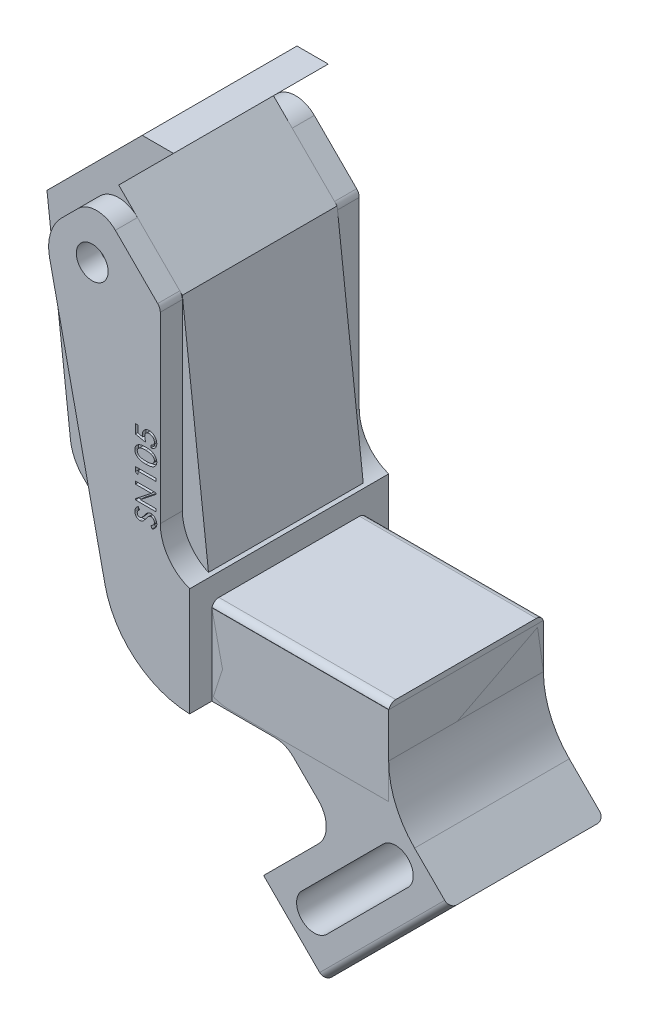
from build123d import *

# Parameters (mm, degrees)
BOSS_EXTRUDE1_DEPTH     = 11.1125
BOSS_EXTRUDE2_DEPTH     = 11.1125
FILLET6_R               = 3.175
FILLET7_R               = 12.7
CUT_EXTRUDE1_DEPTH      = 277.494438503
CUT_EXTRUDE1_DEPTH_BACK = 277.494438503
SKETCH3_R               = 2.286
FILLET9_R               = 6.35
SKETCH4_R               = 2.286
BOSS_EXTRUDE3_DEPTH     = 3.175
BOSS_EXTRUDE4_DEPTH     = 28.575
FILLET10_R              = 6.35
SKETCH7_W               = 22.225
SKETCH7_H               = 12.93
CUT_EXTRUDE4_DEPTH      = 169.905984291
FILLET11_R              = 1.016
BOSS_EXTRUDE5_DEPTH     = 22.225
FILLET12_START          = -11.1125
FILLET12_DEPTH          = 22.225
BOSS_EXTRUDE6_DEPTH     = 22.225
FILLET13_R              = 12.7
FILLET14_R              = 1.016
CUT_EXTRUDE5_DEPTH      = 286.708740637
FILLET15_R              = 3.81
FILLET16_R              = 3.81
FILLET17_R              = 1.27
FILLET18_R              = 1.27
CUT_EXTRUDE6_DEPTH      = 0.5
CUT_EXTRUDE7_DEPTH      = 0.5


with BuildPart() as part:
    # Sketch1 → Boss-Extrude1 (new, symmetric)
    with BuildSketch(Plane.XY):
        with BuildLine():
            Line((217.494802693, 42.707577478), (234.037042979, 26.165337192))
            ThreePointArc((234.037042979, 26.165337192), (236.097131244, 24.788830222), (238.527171039, 24.305465253))
            Line((238.527171039, 24.305465253), (261.378110414, 24.305465253))
            Line((261.378110414, 24.305465253), (261.378110414, 35.735465253))
            Line((261.378110414, 35.735465253), (235.978110414, 35.735465253))
            Line((235.978110414, 35.735465253), (231.749220619, 72.474188019))
            Line((231.749220619, 72.474188019), (222.607319888, 81.61608875))
            Line((222.607319888, 81.61608875), (230.47402425, 89.482793112))
            Line((230.47402425, 89.482793112), (225.983896189, 89.482793112))
            Line((225.983896189, 89.482793112), (212.300717241, 75.799614165))
            Line((212.300717241, 75.799614165), (213.707886072, 63.574754203))
            Line((213.707886072, 63.574754203), (215.67658494, 46.47156981))
            ThreePointArc((215.67658494, 46.47156981), (216.267092957, 44.435671699), (217.494802693, 42.707577478))
        make_face()
    extrude(amount=BOSS_EXTRUDE1_DEPTH, both=True)


with BuildPart() as body_2:
    # Sketch2 → Boss-Extrude2 (new, symmetric)
    with BuildSketch(Plane.XY):
        Polygon((233.302439438, 24.104081998), (225.983896189, 24.104081998), (215.12365511, 74.132423973), (222.607319888, 81.61608875), (231.750210568, 72.47319807), (231.750210568, 36.499281998), (247.333746609, 36.499281998), (261.378110414, 36.499281998), (261.378110414, 24.104081998), (247.333746609, 24.104081998), align=None)
    extrude(amount=BOSS_EXTRUDE2_DEPTH, both=True)

    # Fillet6
    fillet6_edges = [body_2.edges().sort_by_distance(p)[0] for p in [
        (231.750210568, 36.499281998, 0),
    ]]
    fillet(fillet6_edges, radius=FILLET6_R)

    # Fillet7
    fillet7_edges = [body_2.edges().sort_by_distance(p)[0] for p in [
        (225.983896189, 24.104081998, 0),
    ]]
    fillet(fillet7_edges, radius=FILLET7_R)

    # Sketch3 → Cut-Extrude1 (cut, two sides: drawn at the far end of the back side and taken through both)
    with BuildSketch(Plane.XY.offset(-CUT_EXTRUDE1_DEPTH_BACK)):
        with Locations((221.978701959, 73.264450558)):
            Circle(SKETCH3_R)
    extrude(amount=CUT_EXTRUDE1_DEPTH + CUT_EXTRUDE1_DEPTH_BACK, mode=Mode.SUBTRACT)

    # Fillet9
    fillet9_edges = [body_2.edges().sort_by_distance(p)[0] for p in [
        (215.12365511, 74.132423973, 0),
    ]]
    fillet(fillet9_edges, radius=FILLET9_R)

    # Sketch4 → Boss-Extrude3 (add)
    with BuildSketch(Plane.XY.offset(11.1125)):
        with BuildLine():
            Line((235.978110414, 24.106438526), (235.978110414, 36.49692547))
            Line((235.978110414, 36.49692547), (235.978110414, 36.499281998))
            Line((235.978110414, 36.499281998), (234.925210568, 36.499281998))
            ThreePointArc((234.925210568, 36.499281998), (232.680146538, 37.429217968), (231.750210568, 39.674281998))
            Line((231.750210568, 39.674281998), (231.750210568, 72.47319807))
            Line((231.750210568, 72.47319807), (222.607319888, 81.61608875))
            Line((222.607319888, 81.61608875), (217.574184638, 76.582953501))
            ThreePointArc((217.574184638, 76.582953501), (215.971921031, 73.883150485), (215.858844337, 70.745731378))
            Line((215.858844337, 70.745731378), (223.811816826, 34.109893874))
            ThreePointArc((223.811816826, 34.109893874), (228.156886881, 26.994301425), (235.978110414, 24.106438526))
        make_face()
        with Locations((221.978701959, 73.264450558)):
            Circle(SKETCH4_R, mode=Mode.SUBTRACT)
    boss_extrude3 = extrude(amount=BOSS_EXTRUDE3_DEPTH)

    # Mirror1: Boss-Extrude3 across plane
    add(boss_extrude3.mirror(Plane.XY))

    # Sketch6 → Boss-Extrude4 (add)
    with BuildSketch(Plane.XY.offset(14.2875)):
        with BuildLine():
            Line((235.978110414, 36.499281998), (235.978110414, 39.674281998))
            Line((235.978110414, 39.674281998), (231.750210568, 39.674281998))
            ThreePointArc((231.750210568, 39.674281998), (232.680146538, 37.429217968), (234.925210568, 36.499281998))
            Line((234.925210568, 36.499281998), (235.978110414, 36.499281998))
        make_face()
    extrude(amount=-BOSS_EXTRUDE4_DEPTH)

    # Fillet10
    # the kernel refuses this fillet: 6.35 mm, written as the material it adds along each edge
    with BuildSketch(Plane(origin=(231.750210568, 39.674281998, -14.2875), x_dir=(0, 1, 0), z_dir=(0, 0, 1))) as fillet10_piece_1:
        with BuildLine():
            CenterArc((5.984913611, -6.35), FILLET10_R, 90, 70.476770951)
            Line((0, -4.227899846), (-0.119698272, -4.185457843))
            ThreePointArc((-0.119698272, -4.185457843), (-0.127, -2.113949923), (-0.127, 0))
            Line((-0.127, 0), (0, 0.127))
            Line((0, 0.127), (5.984913611, 0.127))
            Line((5.984913611, 0.127), (5.984913611, 0))
        make_face()
    extrude(amount=28.575)

    # Sketch7 → Cut-Extrude4 (cut, through all)
    with BuildSketch(Plane(origin=(152.111704319, 152.111704319, 0), x_dir=(0, 0, -1), z_dir=(0.7071067811865449, 0.7071067811865501, 0))):
        with Locations((0, -106.160855625)):
            Rectangle(SKETCH7_W, SKETCH7_H)
    extrude(amount=-CUT_EXTRUDE4_DEPTH, mode=Mode.SUBTRACT)

    # Fillet11
    fillet11_edges = [body_2.edges().sort_by_distance(p)[0] for p in [
        (248.678110414, 36.499281998, -11.1125),
        (248.678110414, 36.499281998, 11.1125),
    ]]
    fillet(fillet11_edges, radius=FILLET11_R)

    # Sketch9 → Boss-Extrude5 (add)
    with BuildSketch(Plane.XY.offset(-11.1125)):
        with BuildLine():
            Line((218.385153144, 59.108140645), (219.719882264, 60.442869765))
            Line((219.719882264, 60.442869765), (216.519192457, 75.187036407))
            ThreePointArc((216.519192457, 75.187036407), (215.783358892, 73.026698707), (215.858844337, 70.745731378))
            Line((215.858844337, 70.745731378), (218.385153144, 59.108140645))
        make_face()
    extrude(amount=BOSS_EXTRUDE5_DEPTH)

    # Fillet12: read off the stored shape, not the designer's step
    # Fillet12 outline → Fillet12 (cut)
    with BuildSketch(Plane.XY.offset(FILLET12_START)):
        with BuildLine():
            ThreePointArc((216.519192457, 75.187036407), (216.345748441, 74.853354888), (216.192361582, 74.509991154))
            ThreePointArc((216.192361582, 74.509991154), (216.449656469, 74.666313389), (216.675458361, 74.467188288))
            Line((216.675458361, 74.467188288), (216.519192457, 75.187036407))
        make_face()
    extrude(amount=FILLET12_DEPTH, mode=Mode.SUBTRACT)

    # Sketch10 → Boss-Extrude6 (add)
    with BuildSketch(Plane.XY.offset(11.1125)):
        with BuildLine():
            Line((270.142840388, 15.339352024), (261.378110414, 24.104081998))
            Line((261.378110414, 24.104081998), (246.58327829, 24.104081998))
            Line((246.58327829, 24.104081998), (245.063154175, 24.104081998))
            ThreePointArc((245.063154175, 24.104081998), (246.488038822, 23.806717506), (247.697423742, 22.996711324))
            Line((247.697423742, 22.996711324), (251.292719984, 19.42327698))
            ThreePointArc((251.292719984, 19.42327698), (252.416867116, 16.726806305), (251.300948381, 14.026919965))
            Line((251.300948381, 14.026919965), (243.417598172, 6.143569756))
            Line((243.417598172, 6.143569756), (252.182328146, -2.621160218))
            Line((252.182328146, -2.621160218), (270.142840388, 15.339352024))
        make_face()
    extrude(amount=-BOSS_EXTRUDE6_DEPTH)

    # Fillet13
    fillet13_edges = [body_2.edges().sort_by_distance(p)[0] for p in [
        (261.378110414, 24.104081998, 0),
    ]]
    fillet(fillet13_edges, radius=FILLET13_R)

    # Fillet14
    fillet14_edges = [body_2.edges().sort_by_distance(p)[0] for p in [
        (261.162584267, 6.359095903, -11.1125),
        (261.162584267, 6.359095903, 11.1125),
    ]]
    fillet(fillet14_edges, radius=FILLET14_R)

    # Sketch8 → Cut-Extrude5 (cut, through all)
    with BuildSketch(Plane.XY.offset(11.1125)):
        with BuildLine():
            Line((246.773110414, 27.406081998), (240.423110414, 27.406081998))
            ThreePointArc((240.423110414, 27.406081998), (237.883110414, 29.946081998), (240.423110414, 32.486081998))
            Line((240.423110414, 32.486081998), (246.773110414, 32.486081998))
            ThreePointArc((246.773110414, 32.486081998), (249.313110414, 29.946081998), (246.773110414, 27.406081998))
        make_face()
        with BuildLine():
            Line((264.161989812, 15.034023316), (252.487656854, 3.359690358))
            ThreePointArc((252.487656854, 3.359690358), (248.895554406, 3.359690358), (248.895554406, 6.951792807))
            Line((248.895554406, 6.951792807), (260.569887363, 18.626125764))
            ThreePointArc((260.569887363, 18.626125764), (264.161989812, 18.626125764), (264.161989812, 15.034023316))
        make_face()
    extrude(amount=-CUT_EXTRUDE5_DEPTH, mode=Mode.SUBTRACT)

    # Fillet15
    fillet15_edges = [body_2.edges().sort_by_distance(p)[0] for p in [
        (222.607319888, 81.61608875, -12.7),
        (222.607319888, 81.61608875, 12.7),
    ]]
    fillet(fillet15_edges, radius=FILLET15_R)

    # Fillet16
    fillet16_edges = [body_2.edges().sort_by_distance(p)[0] for p in [
        (219.719882264, 60.442869765, 0),
    ]]
    fillet(fillet16_edges, radius=FILLET16_R)

    # Fillet17
    fillet17_edges = [body_2.edges().sort_by_distance(p)[0] for p in [
        (231.750210568, 72.47319807, 0),
    ]]
    fillet(fillet17_edges, radius=FILLET17_R)

    # Fillet18
    fillet18_edges = [body_2.edges().sort_by_distance(p)[0] for p in [
        (231.750210568, 72.47319807, -12.7),
        (231.750210568, 72.47319807, 12.7),
    ]]
    fillet(fillet18_edges, radius=FILLET18_R)

    # Sketch11 → Cut-Extrude6 (cut)
    # profile 1 of 5: a face of its own
    with BuildSketch(Plane.XY.offset(14.2875)):
        with BuildLine():
            Line((228.171981142, 56.325302102), (228.518134988, 56.325302102))
            Line((228.518134988, 56.325302102), (228.518134988, 55.339725179))
            Line((228.518134988, 55.339725179), (229.229072488, 55.178667487))
            add(Edge.make_bspline(
                [(229.229072488, 55.178667487), (229.220017277, 55.197456885), (229.20138158, 55.236125616), (229.185144211, 55.300773859), (229.173719615, 55.370963439), (229.17257584, 55.419998806), (229.171981142, 55.44549441)],
                knots=[0, 0, 0, 0, 0.906577793, 1.865744317, 2.890308309, 4, 4, 4, 4], degree=3))
            add(Edge.make_bspline(
                [(229.171981142, 55.44549441), (229.172642273, 55.481603961), (229.173940294, 55.552499027), (229.188445193, 55.655822906), (229.210175476, 55.754280756), (229.242593022, 55.847062621), (229.282500557, 55.935228043), (229.332439039, 56.017820525), (229.391561348, 56.094754285), (229.458860785, 56.165926419), (229.532166017, 56.230793594), (229.611328542, 56.286505695), (229.694035757, 56.334798592), (229.781716924, 56.373078119), (229.873465072, 56.403322909), (229.969663658, 56.424832244), (230.070024447, 56.438506328), (230.138482963, 56.439953286), (230.173183065, 56.440686718)],
                knots=[0, 0, 0, 0, 1.094894284, 2.149641875, 3.159658044, 4.149576056, 5.125966368, 6.091225838, 7.071072142, 8.064343292, 9.05924964, 10.03573454, 10.996966885, 11.96032995, 12.932910184, 13.923798045, 14.947619342, 16, 16, 16, 16], degree=3))
            add(Edge.make_bspline(
                [(230.173183065, 56.440686718), (230.197430322, 56.440121169), (230.245395469, 56.43900242), (230.316723002, 56.433211456), (230.38667991, 56.421998482), (230.455540017, 56.40756472), (230.522644133, 56.386928758), (230.588986366, 56.363966593), (230.653723175, 56.335548598), (230.716685459, 56.30313794), (230.777401896, 56.267169948), (230.835138399, 56.227569614), (230.889434081, 56.184244703), (230.939829276, 56.137038749), (230.987640334, 56.087254681), (231.031544046, 56.033545667), (231.071951214, 55.976330983), (231.108289777, 55.915664513), (231.141649837, 55.852464921), (231.170515756, 55.786430644), (231.194326985, 55.71779402), (231.214466978, 55.646816882), (231.229995165, 55.573338239), (231.240626007, 55.497221815), (231.247466725, 55.418775979), (231.248419558, 55.365580997), (231.248904219, 55.338523256)],
                knots=[0, 0, 0, 0, 1.012336834, 2.002572232, 2.984155403, 3.968228552, 4.936544053, 5.912447813, 6.897337724, 7.884638455, 8.866969282, 9.84111611, 10.804871742, 11.763389532, 12.72154252, 13.684064009, 14.656127098, 15.642754811, 16.633907714, 17.637469351, 18.6476974, 19.66420429, 20.715439128, 21.779729179, 22.870654523, 24, 24, 24, 24], degree=3))
            add(Edge.make_bspline(
                [(231.248904219, 55.338523256), (231.248172496, 55.308047683), (231.246728957, 55.24792568), (231.236492258, 55.159623421), (231.219118264, 55.074914815), (231.194266004, 54.994145184), (231.163029476, 54.916763413), (231.124576072, 54.843148332), (231.078199751, 54.773811944), (231.026445735, 54.707823528), (230.967933308, 54.646969187), (230.903751201, 54.592044199), (230.833370541, 54.544709046), (230.758207078, 54.502584577), (230.677183238, 54.467472005), (230.590736195, 54.438567132), (230.498888069, 54.41599913), (230.435301157, 54.406888833), (230.402750373, 54.402225179)],
                knots=[0, 0, 0, 0, 1.049702113, 2.070845243, 3.057432412, 4.024422371, 4.977799232, 5.928475162, 6.879676873, 7.847454403, 8.813779349, 9.783056414, 10.751522543, 11.730745935, 12.747402556, 13.788289899, 14.867803203, 16, 16, 16, 16], degree=3))
            Line((230.402750373, 54.402225179), (230.402750373, 54.777826141))
            add(Edge.make_bspline(
                [(230.402750373, 54.777826141), (230.43418987, 54.784974742), (230.493209176, 54.798394342), (230.573628851, 54.827222175), (230.6420203, 54.858123537), (230.697971784, 54.895904835), (230.743834633, 54.939313896), (230.783814235, 54.987243395), (230.81876259, 55.040527127), (230.848656486, 55.098505075), (230.872398871, 55.16001135), (230.890179575, 55.223532679), (230.90048202, 55.288507223), (230.901994635, 55.332278914), (230.902750373, 55.354148256)],
                knots=[0, 0, 0, 0, 1.385749299, 2.601376231, 3.669181906, 4.606145483, 5.490256194, 6.377385788, 7.285652788, 8.226097454, 9.178313831, 10.117059123, 11.05923951, 12, 12, 12, 12], degree=3))
            add(Edge.make_bspline(
                [(230.902750373, 55.354148256), (230.90195629, 55.377811302), (230.900388523, 55.424529534), (230.890994385, 55.493349271), (230.87364406, 55.559181123), (230.851067272, 55.622906086), (230.820602682, 55.683765141), (230.783861362, 55.742047305), (230.740818315, 55.797996863), (230.691154772, 55.850152208), (230.63715426, 55.898565808), (230.579086545, 55.941031107), (230.517460902, 55.976753734), (230.452208363, 56.005417114), (230.383933764, 56.028644342), (230.312206889, 56.044618388), (230.237167717, 56.054582346), (230.186035764, 56.055568474), (230.159961911, 56.056071333)],
                knots=[0, 0, 0, 0, 0.997612858, 1.969598932, 2.919814029, 3.862647825, 4.814212446, 5.781714047, 6.76293457, 7.784311432, 8.812956487, 9.816127914, 10.811057329, 11.808955995, 12.815568235, 13.8458753, 14.901541465, 16, 16, 16, 16], degree=3))
            add(Edge.make_bspline(
                [(230.159961911, 56.056071333), (230.136697778, 56.055474105), (230.091016724, 56.054301398), (230.024257101, 56.045693145), (229.960558453, 56.03208487), (229.900430353, 56.01209132), (229.843425026, 55.986930626), (229.790363695, 55.955407106), (229.740795214, 55.918357769), (229.694585085, 55.876595421), (229.653036092, 55.829645113), (229.61702606, 55.778320654), (229.585843387, 55.72338621), (229.561657297, 55.663968635), (229.541432575, 55.601430339), (229.527693899, 55.534745064), (229.520073022, 55.464103107), (229.518792264, 55.41566501), (229.518134988, 55.39080691)],
                knots=[0, 0, 0, 0, 1.071193312, 2.10337684, 3.095060095, 4.066582879, 5.016443166, 5.959468544, 6.902358523, 7.86242427, 8.82319901, 9.783087426, 10.745499713, 11.725570806, 12.732204581, 13.768995727, 14.855063875, 16, 16, 16, 16], degree=3))
            add(Edge.make_bspline(
                [(229.518134988, 55.39080691), (229.518644989, 55.369555648), (229.519715685, 55.324940809), (229.527457603, 55.255126521), (229.539634556, 55.179154728), (229.55647595, 55.097145563), (229.578416879, 55.00902022), (229.605003905, 54.914671612), (229.636027818, 54.813995342), (229.659756217, 54.745306258), (229.671981142, 54.709917487)],
                knots=[0, 0, 0, 0, 0.727614075, 1.527550888, 2.402655696, 3.361819828, 4.39328773, 5.511706796, 6.718025739, 8, 8, 8, 8], degree=3))
            Line((229.671981142, 54.709917487), (228.171981142, 55.024821333))
            Line((228.171981142, 55.024821333), (228.171981142, 56.325302102))
        make_face()
    # profile 2 of 5: a face of its own
    with BuildSketch(Plane.XY.offset(14.2875)):
        with BuildLine():
            add(Edge.make_bspline(
                [(229.673183065, 52.017609794), (229.625500788, 52.017895628), (229.532899945, 52.018450727), (229.398190969, 52.024449519), (229.271740777, 52.034762329), (229.153374179, 52.048142178), (229.043318396, 52.066252895), (228.941322188, 52.087644916), (228.847470421, 52.113190303), (228.76148776, 52.143550781), (228.682071494, 52.177447985), (228.608133161, 52.214808609), (228.538662241, 52.254990559), (228.474138287, 52.298926777), (228.414645056, 52.346523082), (228.35955437, 52.397085858), (228.309530763, 52.451373125), (228.264526825, 52.508878365), (228.225033528, 52.569243275), (228.189722659, 52.630926143), (228.1610934, 52.695172114), (228.13677049, 52.760703399), (228.11816156, 52.828078958), (228.105089633, 52.897231694), (228.096108056, 52.96789439), (228.09540927, 53.015778926), (228.095058065, 53.039845371)],
                knots=[0, 0, 0, 0, 1.622324456, 3.150617435, 4.586648846, 5.938510959, 7.202478824, 8.380218601, 9.483160278, 10.509271742, 11.480323066, 12.419168855, 13.326330289, 14.209199464, 15.072487088, 15.916592079, 16.751065654, 17.581409252, 18.398072447, 19.203768227, 19.996882181, 20.788266268, 21.580354486, 22.37170922, 23.181631988, 24, 24, 24, 24], degree=3))
            add(Edge.make_bspline(
                [(228.095058065, 53.039845371), (228.095724336, 53.066104916), (228.097039438, 53.117936591), (228.10482504, 53.194724985), (228.118477778, 53.269360969), (228.138840872, 53.341641276), (228.163043664, 53.412280378), (228.194002343, 53.480271327), (228.230333954, 53.546050498), (228.271562158, 53.609795539), (228.318769863, 53.670346319), (228.370111967, 53.728487061), (228.427903085, 53.781525426), (228.488930881, 53.832767179), (228.556234211, 53.878380933), (228.627045188, 53.922425507), (228.703907619, 53.960871675), (228.785137588, 53.99759452), (228.8728857, 54.029099981), (228.966779636, 54.057749217), (229.067896354, 54.08068643), (229.175780409, 54.099976243), (229.290512212, 54.114739366), (229.411983542, 54.125663745), (229.540316045, 54.131362456), (229.628106108, 54.132440747), (229.673183065, 54.13299441)],
                knots=[0, 0, 0, 0, 0.874933061, 1.72696246, 2.568656516, 3.399270261, 4.226687105, 5.054103948, 5.884503161, 6.728628031, 7.580317555, 8.440515468, 9.309317894, 10.191197995, 11.092808282, 12.015369172, 12.967534381, 13.953506308, 14.983858955, 16.071232565, 17.222283151, 18.435872307, 19.721483052, 21.074976691, 22.498108497, 24, 24, 24, 24], degree=3))
            add(Edge.make_bspline(
                [(229.673183065, 54.13299441), (229.718059028, 54.132435033), (229.80544733, 54.131345742), (229.933189146, 54.125727626), (230.054000789, 54.114524534), (230.168223922, 54.100738848), (230.275502776, 54.08137282), (230.375737136, 54.057933543), (230.469542579, 54.031336781), (230.556351354, 53.998952651), (230.637765633, 53.963725096), (230.713825631, 53.924202353), (230.785653724, 53.882085381), (230.851592983, 53.834478381), (230.914167285, 53.785167841), (230.970294366, 53.730349673), (231.023343854, 53.67361397), (231.069662176, 53.611998634), (231.112002702, 53.548402314), (231.14888082, 53.482217611), (231.179401538, 53.413485492), (231.204698888, 53.342984162), (231.224960511, 53.270362607), (231.238333312, 53.195282253), (231.247104957, 53.118176723), (231.248300887, 53.06611157), (231.248904219, 53.039845371)],
                knots=[0, 0, 0, 0, 1.496746103, 2.914658371, 4.26288044, 5.542326164, 6.750579158, 7.896298903, 8.974586846, 9.99971989, 10.984004704, 11.931200402, 12.856972565, 13.757870511, 14.641611689, 15.511045065, 16.371655144, 17.229512095, 18.07816251, 18.918488606, 19.75284466, 20.583340168, 21.414802492, 22.263926118, 23.124173082, 24, 24, 24, 24], degree=3))
            add(Edge.make_bspline(
                [(231.248904219, 53.039845371), (231.248492018, 53.015585816), (231.247675626, 52.967538038), (231.239668174, 52.896587967), (231.226379892, 52.827471697), (231.207751249, 52.76039563), (231.184116462, 52.69487584), (231.155425173, 52.631243766), (231.120859824, 52.569642752), (231.081151035, 52.510272347), (231.036855951, 52.453177603), (230.98740026, 52.399279722), (230.932109314, 52.349559405), (230.872848711, 52.301915629), (230.808193732, 52.257839054), (230.738217272, 52.21782065), (230.663424719, 52.180386231), (230.583231144, 52.146110062), (230.496798909, 52.1148528), (230.402278236, 52.089775167), (230.300419146, 52.066419752), (230.190102369, 52.049173588), (230.072317523, 52.034235256), (229.946309139, 52.025563163), (229.812492453, 52.018154306), (229.720470902, 52.017794626), (229.673183065, 52.017609794)],
                knots=[0, 0, 0, 0, 0.826192392, 1.636332947, 2.428658375, 3.221718185, 4.00532592, 4.799412726, 5.596806228, 6.40878423, 7.230568121, 8.056422233, 8.896948786, 9.761295337, 10.645247459, 11.559424645, 12.505520934, 13.492996243, 14.529078204, 15.633372773, 16.82213518, 18.087653454, 19.435208155, 20.865661994, 22.389333089, 24, 24, 24, 24], degree=3))
        make_face()
        with BuildLine():
            add(Edge.make_bspline(
                [(229.671981142, 52.402225179), (229.712250297, 52.402379663), (229.790208369, 52.402678732), (229.903017122, 52.407119437), (230.008059687, 52.413441803), (230.105307587, 52.422899042), (230.19490542, 52.435509966), (230.276729465, 52.450436233), (230.35093644, 52.467454452), (230.417648422, 52.488202407), (230.478433095, 52.511176146), (230.534394215, 52.536718726), (230.586794171, 52.563244796), (230.634613125, 52.593110205), (230.678438157, 52.624791916), (230.718227693, 52.658529738), (230.754148385, 52.694033569), (230.794737007, 52.743982448), (230.837776548, 52.80786736), (230.874418664, 52.887705627), (230.89872545, 52.967916664), (230.901417332, 53.022051709), (230.902750373, 53.048859794)],
                knots=[0, 0, 0, 0, 1.564699439, 3.029141045, 4.386293801, 5.653467961, 6.824775029, 7.901162594, 8.884869747, 9.78110004, 10.613826367, 11.40815699, 12.170610254, 12.894246817, 13.596465232, 14.27023614, 14.919737973, 15.555616169, 16.768951267, 17.900875131, 18.960497409, 20, 20, 20, 20], degree=3))
            add(Edge.make_bspline(
                [(230.902750373, 53.048859794), (230.901146647, 53.07923059), (230.897949175, 53.13978318), (230.875068778, 53.229157524), (230.835437962, 53.314371462), (230.791851567, 53.382291598), (230.749299778, 53.433518698), (230.71307626, 53.47026075), (230.673187169, 53.504757383), (230.629137264, 53.536694021), (230.580803605, 53.565827663), (230.529199268, 53.593866971), (230.473145294, 53.618294186), (230.434081989, 53.632409438), (230.414168642, 53.639604987)],
                knots=[0, 0, 0, 0, 1.332227395, 2.656164195, 4.017280648, 5.441181591, 6.18399097, 6.936103918, 7.702666244, 8.495636149, 9.320275154, 10.177577047, 11.070981315, 12, 12, 12, 12], degree=3))
            add(Edge.make_bspline(
                [(230.414168642, 53.639604987), (230.388005595, 53.648274247), (230.334670411, 53.665947135), (230.251631065, 53.688088834), (230.164497833, 53.706419434), (230.073734746, 53.722203103), (229.978884544, 53.734187667), (229.880038589, 53.742471518), (229.777196272, 53.747223254), (229.707442699, 53.747989486), (229.671981142, 53.748379025)],
                knots=[0, 0, 0, 0, 0.877617242, 1.789083553, 2.735016418, 3.71249782, 4.722174671, 5.778575778, 6.870664861, 8, 8, 8, 8], degree=3))
            add(Edge.make_bspline(
                [(229.671981142, 53.748379025), (229.63651591, 53.748286074), (229.567352771, 53.748104803), (229.466184751, 53.742696996), (229.369883573, 53.736175371), (229.278581303, 53.724828109), (229.191978194, 53.712341337), (229.110751351, 53.69495364), (229.034236346, 53.676412116), (228.963229109, 53.653171414), (228.897056219, 53.628044751), (228.83559076, 53.600754049), (228.778168035, 53.572574368), (228.726491155, 53.540115207), (228.67882865, 53.506775028), (228.635852929, 53.470980907), (228.597067006, 53.433473023), (228.554141601, 53.380150988), (228.509108703, 53.312024583), (228.469850569, 53.226184885), (228.44596508, 53.13808493), (228.442788031, 53.078446269), (228.441211911, 53.048859794)],
                knots=[0, 0, 0, 0, 1.352991806, 2.638560532, 3.86496067, 5.034895808, 6.148335931, 7.202173829, 8.203243308, 9.150794873, 10.050786465, 10.902929054, 11.716489762, 12.488637994, 13.228798888, 13.934409237, 14.620839406, 15.283406362, 16.542711863, 17.72627546, 18.872015391, 20, 20, 20, 20], degree=3))
            add(Edge.make_bspline(
                [(228.441211911, 53.048859794), (228.442560489, 53.022054932), (228.445293466, 52.967733175), (228.469405763, 52.887552701), (228.505557491, 52.807879201), (228.548170884, 52.74434157), (228.588635942, 52.694660764), (228.6243582, 52.659127769), (228.664353909, 52.625997123), (228.708300314, 52.594920869), (228.756109234, 52.565130935), (228.808193309, 52.537786569), (228.864354513, 52.512435036), (228.925095849, 52.489356694), (228.991907373, 52.468786913), (229.066192129, 52.450961301), (229.148153129, 52.435244123), (229.238115891, 52.423723809), (229.335514896, 52.414130562), (229.440721082, 52.406931662), (229.553757013, 52.402733232), (229.631713042, 52.402398226), (229.671981142, 52.402225179)],
                knots=[0, 0, 0, 0, 1.039577923, 2.106770756, 3.228450758, 4.431088035, 5.067012313, 5.716561215, 6.385370734, 7.083094838, 7.806783842, 8.572900059, 9.367288246, 10.200074921, 11.096370163, 12.081964178, 13.167511641, 14.337842538, 15.605108529, 16.970639435, 18.435187169, 20, 20, 20, 20], degree=3))
        make_face(mode=Mode.SUBTRACT)
    # profile 3 of 5: a face of its own
    with BuildSketch(Plane.XY.offset(14.2875)):
        Polygon((228.171981142, 50.326504025), (228.171981142, 50.979148256), (231.171981142, 50.979148256), (231.171981142, 50.594532871), (228.518134988, 50.594532871), (228.518134988, 50.13299441), align=None)
    # profile 4 of 5: a face of its own
    with BuildSketch(Plane.XY.offset(14.2875)):
        Polygon((231.171981142, 46.825302102), (228.171981142, 46.825302102), (228.171981142, 46.967729987), (230.451428257, 48.786840564), (228.171981142, 48.786840564), (228.171981142, 49.171455948), (231.171981142, 49.171455948), (231.171981142, 49.014004025), (228.898543642, 47.209917487), (231.171981142, 47.209917487), align=None)
    # profile 5 of 5: a face of its own
    with BuildSketch(Plane.XY.offset(14.2875)):
        with BuildLine():
            Line((230.577029219, 44.402225179), (230.402750373, 44.729148256))
            add(Edge.make_bspline(
                [(230.402750373, 44.729148256), (230.44221419, 44.75297298), (230.517640478, 44.798508628), (230.619248643, 44.873280473), (230.705893704, 44.947623938), (230.777488175, 45.022272883), (230.832882039, 45.098264237), (230.872916341, 45.174822215), (230.898079231, 45.252425976), (230.901210066, 45.304896384), (230.902750373, 45.330710756)],
                knots=[0, 0, 0, 0, 1.354943589, 2.589672558, 3.704607527, 4.708856974, 5.624398268, 6.459549776, 7.242129862, 8, 8, 8, 8], degree=3))
            add(Edge.make_bspline(
                [(230.902750373, 45.330710756), (230.901979584, 45.354811514), (230.900452872, 45.402548181), (230.887089964, 45.472658979), (230.867004465, 45.540737998), (230.837286186, 45.604972006), (230.801989129, 45.664490808), (230.760581704, 45.717489088), (230.712883918, 45.761904162), (230.660389441, 45.7987559), (230.604413912, 45.827406051), (230.546472135, 45.849014908), (230.486188309, 45.861181442), (230.445469541, 45.862899414), (230.42498595, 45.863763641)],
                knots=[0, 0, 0, 0, 1.088997877, 2.156991516, 3.217388347, 4.291818049, 5.34833773, 6.341591841, 7.322247079, 8.284867584, 9.233012414, 10.158731431, 11.073749165, 12, 12, 12, 12], degree=3))
            add(Edge.make_bspline(
                [(230.42498595, 45.863763641), (230.401634795, 45.86258523), (230.354447451, 45.860203931), (230.284350089, 45.841091051), (230.214938597, 45.810029133), (230.171600623, 45.781296159), (230.149144603, 45.766407871)],
                knots=[0, 0, 0, 0, 0.941861274, 1.903286225, 2.913566088, 4, 4, 4, 4], degree=3))
            add(Edge.make_bspline(
                [(230.149144603, 45.766407871), (230.132796097, 45.753535868), (230.098381103, 45.726439209), (230.046613687, 45.680530718), (229.992501764, 45.627099458), (229.937177637, 45.565065731), (229.877136901, 45.497707578), (229.816287635, 45.421575879), (229.752480914, 45.338548279), (229.709728689, 45.280315182), (229.687606142, 45.25018191)],
                knots=[0, 0, 0, 0, 0.718605451, 1.5127255, 2.388525841, 3.34361075, 4.383114545, 5.504804886, 6.708837455, 8, 8, 8, 8], degree=3))
            add(Edge.make_bspline(
                [(229.687606142, 45.25018191), (229.665271086, 45.219458321), (229.622416368, 45.160508357), (229.559591153, 45.077453006), (229.501662824, 45.0029858), (229.448586103, 44.937677783), (229.399899672, 44.881521532), (229.355803312, 44.834635345), (229.317507143, 44.795607754), (229.291739683, 44.774635438), (229.280154219, 44.765205948)],
                knots=[0, 0, 0, 0, 1.435833971, 2.754963323, 3.936484598, 5.002077172, 5.935979083, 6.744956812, 7.435712417, 8, 8, 8, 8], degree=3))
            add(Edge.make_bspline(
                [(229.280154219, 44.765205948), (229.26236749, 44.751440167), (229.22742403, 44.724396183), (229.171372458, 44.690157563), (229.114587302, 44.660695997), (229.056542766, 44.636430029), (228.997424283, 44.617625365), (228.937024528, 44.604688646), (228.875583422, 44.595563308), (228.834074101, 44.594877588), (228.813207103, 44.594532871)],
                knots=[0, 0, 0, 0, 1.064105702, 2.090521257, 3.104283852, 4.09061442, 5.065433238, 6.036507983, 7.012940167, 8, 8, 8, 8], degree=3))
            add(Edge.make_bspline(
                [(228.813207103, 44.594532871), (228.780662923, 44.59561162), (228.716227828, 44.597747463), (228.622018493, 44.617091583), (228.532096093, 44.647945851), (228.447268527, 44.690633432), (228.369005465, 44.744636456), (228.299378437, 44.809593709), (228.238647778, 44.884503117), (228.187537938, 44.968324377), (228.146049715, 45.058622401), (228.116488138, 45.153741103), (228.098564651, 45.252510742), (228.096235589, 45.319618871), (228.095058065, 45.353547294)],
                knots=[0, 0, 0, 0, 1.004420661, 1.988679422, 2.957408046, 3.934344295, 4.912808141, 5.884871468, 6.865856503, 7.882630634, 8.910008354, 9.927798902, 10.952339793, 12, 12, 12, 12], degree=3))
            add(Edge.make_bspline(
                [(228.095058065, 45.353547294), (228.096351696, 45.392087793), (228.098914861, 45.4684509), (228.118666755, 45.580650246), (228.15075354, 45.688508124), (228.187809337, 45.774990824), (228.225372845, 45.842287838), (228.259345052, 45.893175056), (228.297779177, 45.945335046), (228.342606189, 45.997111695), (228.391652877, 46.050524171), (228.447586587, 46.102836984), (228.507201323, 46.157360834), (228.550193974, 46.192112338), (228.572221526, 46.209917487)],
                knots=[0, 0, 0, 0, 1.360687177, 2.696028959, 4.010076158, 5.328383209, 6.009416266, 6.72960499, 7.488083515, 8.296188009, 9.147227534, 10.04798982, 10.999875445, 12, 12, 12, 12], degree=3))
            Line((228.572221526, 46.209917487), (228.787365757, 45.896215564))
            add(Edge.make_bspline(
                [(228.787365757, 45.896215564), (228.769886329, 45.879843827), (228.736277776, 45.848365087), (228.688605499, 45.802068265), (228.645859129, 45.758237625), (228.608075544, 45.716859996), (228.575015886, 45.678382549), (228.546328824, 45.643142597), (228.523477534, 45.609720299), (228.498748029, 45.569675028), (228.475586655, 45.519450597), (228.455339068, 45.457810086), (228.443889514, 45.393431768), (228.442111336, 45.349783685), (228.441211911, 45.327705948)],
                knots=[0, 0, 0, 0, 1.253107226, 2.40941069, 3.47678296, 4.456123335, 5.340621692, 6.131268771, 6.831968122, 7.457534638, 8.592258907, 9.715940433, 10.844694599, 12, 12, 12, 12], degree=3))
            add(Edge.make_bspline(
                [(228.441211911, 45.327705948), (228.442312991, 45.304144408), (228.44445358, 45.258338849), (228.462784125, 45.192541566), (228.4917091, 45.132057956), (228.532645684, 45.078694455), (228.583314215, 45.034340382), (228.642665981, 45.001811992), (228.710305207, 44.982775482), (228.757794083, 44.980391453), (228.782558065, 44.979148256)],
                knots=[0, 0, 0, 0, 1.033513523, 2.009234674, 2.977584268, 3.963375862, 4.942860848, 5.915719707, 6.913112236, 8, 8, 8, 8], degree=3))
            add(Edge.make_bspline(
                [(228.782558065, 44.979148256), (228.798604327, 44.979632644), (228.83065804, 44.98060025), (228.878138703, 44.987707583), (228.924016287, 45.000845486), (228.969257781, 45.017493863), (229.013608985, 45.040795887), (229.057139932, 45.070472406), (229.101104746, 45.105701173), (229.128743146, 45.132737957), (229.143134988, 45.146816525)],
                knots=[0, 0, 0, 0, 0.940834015, 1.879392378, 2.805520916, 3.734846727, 4.701501436, 5.734192883, 6.820151034, 8, 8, 8, 8], degree=3))
            add(Edge.make_bspline(
                [(229.143134988, 45.146816525), (229.149841204, 45.153945104), (229.165233375, 45.170306687), (229.188803354, 45.200315588), (229.218353812, 45.236876756), (229.253402434, 45.280497059), (229.292046377, 45.332610831), (229.336867373, 45.391291242), (229.385847634, 45.458024084), (229.42018612, 45.504984172), (229.438207103, 45.529629025)],
                knots=[0, 0, 0, 0, 0.485581606, 1.114511607, 1.892484918, 2.819534315, 3.891398566, 5.11240712, 6.484579029, 8, 8, 8, 8], degree=3))
            add(Edge.make_bspline(
                [(229.438207103, 45.529629025), (229.462680449, 45.563204859), (229.510024988, 45.628158477), (229.581437996, 45.720427323), (229.651440308, 45.80364079), (229.717589709, 45.879902714), (229.782661034, 45.946634047), (229.84531634, 46.005085109), (229.904944062, 46.055989935), (229.980967741, 46.110356899), (230.074691875, 46.164712965), (230.187975102, 46.213318523), (230.302151999, 46.242322983), (230.378358443, 46.24637773), (230.415971526, 46.248379025)],
                knots=[0, 0, 0, 0, 1.186540699, 2.295404303, 3.331123753, 4.291760032, 5.17774712, 5.991329992, 6.738459906, 7.414799035, 8.65800623, 9.82461674, 10.926299804, 12, 12, 12, 12], degree=3))
            add(Edge.make_bspline(
                [(230.415971526, 46.248379025), (230.442657472, 46.247527493), (230.495697829, 46.245835007), (230.574121202, 46.233563692), (230.650346779, 46.213146194), (230.724049098, 46.183768701), (230.795933593, 46.147138199), (230.865318864, 46.101672813), (230.932032051, 46.047828295), (230.995792555, 45.986967228), (231.055046325, 45.920421613), (231.106923806, 45.848516417), (231.151265361, 45.772608085), (231.186388733, 45.692082787), (231.215203447, 45.608243761), (231.234884869, 45.519974517), (231.246258518, 45.427765031), (231.248013025, 45.364997204), (231.248904219, 45.333114602)],
                knots=[0, 0, 0, 0, 0.932738639, 1.853889356, 2.767877299, 3.686041414, 4.622558463, 5.584089528, 6.580490983, 7.61578374, 8.662665956, 9.690923261, 10.710750907, 11.729736566, 12.757349726, 13.805636525, 14.885384091, 16, 16, 16, 16], degree=3))
            add(Edge.make_bspline(
                [(231.248904219, 45.333114602), (231.248387828, 45.309865573), (231.247370752, 45.2640746), (231.240919258, 45.196094346), (231.22851955, 45.12994109), (231.212487978, 45.065252138), (231.192073934, 45.001987115), (231.16596063, 44.940961333), (231.135965892, 44.88115857), (231.10084516, 44.822921884), (231.059721548, 44.766177013), (231.011985124, 44.710601482), (230.956796739, 44.656518116), (230.894873407, 44.602999812), (230.825518618, 44.550753617), (230.749097064, 44.499901505), (230.66585518, 44.449794186), (230.607221466, 44.418394047), (230.577029219, 44.402225179)],
                knots=[0, 0, 0, 0, 0.916943493, 1.805999526, 2.689245248, 3.568702553, 4.433092864, 5.307568578, 6.183755457, 7.069823058, 7.986358083, 8.944343836, 9.955449961, 11.030835633, 12.170024038, 13.377301724, 14.649494474, 16, 16, 16, 16], degree=3))
        make_face()
    extrude(amount=-CUT_EXTRUDE6_DEPTH, mode=Mode.SUBTRACT)

    # Sketch12 → Cut-Extrude7 (cut)
    # profile 1 of 5: a face of its own
    with BuildSketch(Plane(origin=(0, 0, -14.2875), x_dir=(-1, 0, 0), z_dir=(0, 0, -1))):
        with BuildLine():
            Line((-230.577029219, 56.479148256), (-230.402750373, 56.152225179))
            add(Edge.make_bspline(
                [(-230.402750373, 56.152225179), (-230.44221419, 56.128400455), (-230.517640478, 56.082864807), (-230.619248643, 56.008092963), (-230.705893704, 55.933749497), (-230.777488175, 55.859100552), (-230.832882039, 55.783109198), (-230.872916341, 55.70655122), (-230.898079231, 55.628947459), (-230.901210066, 55.576477051), (-230.902750373, 55.550662679)],
                knots=[0, 0, 0, 0, 1.354943589, 2.589672558, 3.704607527, 4.708856974, 5.624398268, 6.459549776, 7.242129862, 8, 8, 8, 8], degree=3))
            add(Edge.make_bspline(
                [(-230.902750373, 55.550662679), (-230.901975785, 55.526563511), (-230.900441548, 55.478829993), (-230.887134111, 55.408695981), (-230.866862722, 55.340783383), (-230.837980301, 55.276289541), (-230.802653496, 55.216647661), (-230.76034488, 55.164093923), (-230.713139618, 55.118790687), (-230.66032753, 55.082127677), (-230.604411822, 55.053026026), (-230.546073302, 55.032747958), (-230.48602565, 55.020067368), (-230.44548085, 55.018434958), (-230.42498595, 55.017609794)],
                knots=[0, 0, 0, 0, 1.088566894, 2.156137864, 3.216115032, 4.286409646, 5.342511199, 6.341014339, 7.327494598, 8.289734136, 9.237503728, 10.168335026, 11.074115738, 12, 12, 12, 12], degree=3))
            add(Edge.make_bspline(
                [(-230.42498595, 55.017609794), (-230.401612967, 55.018715029), (-230.354330052, 55.02095089), (-230.28460608, 55.04121967), (-230.214770566, 55.071139715), (-230.171566351, 55.099992037), (-230.149144603, 55.114965564)],
                knots=[0, 0, 0, 0, 0.942144539, 1.905933023, 2.913239343, 4, 4, 4, 4], degree=3))
            add(Edge.make_bspline(
                [(-230.149144603, 55.114965564), (-230.132798252, 55.127839523), (-230.098387793, 55.1549403), (-230.046582313, 55.20081423), (-229.992541511, 55.254492748), (-229.936509184, 55.315888779), (-229.877229817, 55.383923168), (-229.816235514, 55.459751588), (-229.752495462, 55.542837987), (-229.70973365, 55.601062628), (-229.687606142, 55.631191525)],
                knots=[0, 0, 0, 0, 0.718593868, 1.512701116, 2.388487339, 3.348232282, 4.383172848, 5.504845107, 6.708858268, 8, 8, 8, 8], degree=3))
            add(Edge.make_bspline(
                [(-229.687606142, 55.631191525), (-229.665271086, 55.661915114), (-229.622416368, 55.720865078), (-229.559591153, 55.803920429), (-229.501662824, 55.878387635), (-229.448586103, 55.943695652), (-229.399899672, 55.999851903), (-229.355803312, 56.04673809), (-229.317507143, 56.085765682), (-229.291739683, 56.106737997), (-229.280154219, 56.116167487)],
                knots=[0, 0, 0, 0, 1.435833971, 2.754963323, 3.936484598, 5.002077172, 5.935979083, 6.744956812, 7.435712417, 8, 8, 8, 8], degree=3))
            add(Edge.make_bspline(
                [(-229.280154219, 56.116167487), (-229.26236749, 56.129933268), (-229.22742403, 56.156977252), (-229.171372458, 56.191215872), (-229.114587302, 56.220677438), (-229.056542766, 56.244943406), (-228.997424283, 56.26374807), (-228.937024528, 56.27668479), (-228.875583422, 56.285810127), (-228.834074101, 56.286495848), (-228.813207103, 56.286840564)],
                knots=[0, 0, 0, 0, 1.064105702, 2.090521257, 3.104283852, 4.09061442, 5.065433238, 6.036507983, 7.012940167, 8, 8, 8, 8], degree=3))
            add(Edge.make_bspline(
                [(-228.813207103, 56.286840564), (-228.780663534, 56.285758776), (-228.716229647, 56.283616917), (-228.622197761, 56.264355164), (-228.532391772, 56.233403617), (-228.447972424, 56.190090268), (-228.369786465, 56.135942508), (-228.29917987, 56.0720069), (-228.238705364, 55.996809258), (-228.187522089, 55.913065863), (-228.146053933, 55.822746561), (-228.11648701, 55.727633528), (-228.098564941, 55.628862385), (-228.096235686, 55.561754461), (-228.095058065, 55.527826141)],
                knots=[0, 0, 0, 0, 1.004646316, 1.989126202, 2.95222254, 3.932177672, 4.910861341, 5.883497635, 6.864703059, 7.88170562, 8.909314152, 9.927333358, 10.952104425, 12, 12, 12, 12], degree=3))
            add(Edge.make_bspline(
                [(-228.095058065, 55.527826141), (-228.096436968, 55.48930241), (-228.099167891, 55.413005974), (-228.11767492, 55.300537855), (-228.150995555, 55.192990701), (-228.187775348, 55.106373339), (-228.22537979, 55.039087492), (-228.259343039, 54.98819783), (-228.297779768, 54.93603855), (-228.342606018, 54.884261693), (-228.391652927, 54.830849277), (-228.447586572, 54.778536448), (-228.507201327, 54.724012602), (-228.550193976, 54.689261098), (-228.572221526, 54.671455948)],
                knots=[0, 0, 0, 0, 1.360590218, 2.69465552, 4.010645498, 5.328858611, 6.009843139, 6.729980544, 7.488405022, 8.296451933, 9.147430815, 10.048128915, 10.999946711, 12, 12, 12, 12], degree=3))
            Line((-228.572221526, 54.671455948), (-228.787365757, 54.985157871))
            add(Edge.make_bspline(
                [(-228.787365757, 54.985157871), (-228.769850655, 55.001493135), (-228.736070913, 55.032997432), (-228.688775204, 55.079879986), (-228.646027581, 55.123694128), (-228.607991016, 55.164620241), (-228.574676255, 55.202777521), (-228.547278837, 55.239188659), (-228.523460454, 55.271767994), (-228.499406292, 55.312068324), (-228.476156143, 55.362157959), (-228.455369327, 55.423702451), (-228.443863872, 55.48813875), (-228.442105402, 55.531589734), (-228.441211911, 55.553667487)],
                knots=[0, 0, 0, 0, 1.253529984, 2.417566204, 3.48529857, 4.457251953, 5.342048711, 6.134767478, 6.841715926, 7.453097701, 8.588204789, 9.725488963, 10.844304836, 12, 12, 12, 12], degree=3))
            add(Edge.make_bspline(
                [(-228.441211911, 55.553667487), (-228.44232106, 55.577225615), (-228.444477337, 55.62302454), (-228.462647131, 55.68869437), (-228.491867622, 55.748855249), (-228.532820928, 55.80206218), (-228.583100883, 55.847082518), (-228.642692283, 55.879530609), (-228.710297864, 55.898606561), (-228.757791567, 55.900984932), (-228.782558065, 55.902225179)],
                knots=[0, 0, 0, 0, 1.033786987, 2.00976631, 2.970458119, 3.95651055, 4.942051941, 5.915168215, 6.91282465, 8, 8, 8, 8], degree=3))
            add(Edge.make_bspline(
                [(-228.782558065, 55.902225179), (-228.798605828, 55.901744834), (-228.830662538, 55.900785306), (-228.878120859, 55.893617773), (-228.924151753, 55.880686346), (-228.969139245, 55.863145352), (-229.013441074, 55.839948369), (-229.057329253, 55.810978911), (-229.101075812, 55.775630756), (-229.128733238, 55.748621266), (-229.143134988, 55.73455691)],
                knots=[0, 0, 0, 0, 0.941102048, 1.879927795, 2.806320176, 3.740133313, 4.70706341, 5.733547381, 6.819814909, 8, 8, 8, 8], degree=3))
            add(Edge.make_bspline(
                [(-229.143134988, 55.73455691), (-229.149841204, 55.727428331), (-229.165233375, 55.711066748), (-229.188803354, 55.681057847), (-229.218353812, 55.644496679), (-229.253402434, 55.600876376), (-229.292046377, 55.548762604), (-229.336867373, 55.490082193), (-229.385847634, 55.423349351), (-229.42018612, 55.376389263), (-229.438207103, 55.35174441)],
                knots=[0, 0, 0, 0, 0.485581606, 1.114511607, 1.892484918, 2.819534315, 3.891398566, 5.11240712, 6.484579029, 8, 8, 8, 8], degree=3))
            add(Edge.make_bspline(
                [(-229.438207103, 55.35174441), (-229.462676027, 55.318164578), (-229.510012011, 55.253203224), (-229.581484655, 55.160988303), (-229.651186439, 55.077705275), (-229.718009418, 55.0020609), (-229.782434545, 54.934721616), (-229.845345718, 54.87631795), (-229.904934437, 54.825368914), (-229.980985472, 54.771057953), (-230.074520096, 54.716423553), (-230.188221601, 54.66900853), (-230.302040928, 54.638829594), (-230.378337728, 54.6349219), (-230.415971526, 54.63299441)],
                knots=[0, 0, 0, 0, 1.186639563, 2.29559556, 3.331401308, 4.287832086, 5.178002532, 5.991653193, 6.738845359, 7.415240842, 8.658551622, 9.823054859, 10.926210341, 12, 12, 12, 12], degree=3))
            add(Edge.make_bspline(
                [(-230.415971526, 54.63299441), (-230.442657461, 54.633845954), (-230.495697797, 54.635538462), (-230.574121328, 54.647809613), (-230.650346311, 54.668227729), (-230.724050872, 54.697602888), (-230.795926748, 54.734242358), (-230.865345556, 54.77967285), (-230.932039796, 54.833746284), (-230.996412479, 54.894181393), (-231.055573484, 54.961007364), (-231.107642972, 55.032670631), (-231.151141531, 55.108952401), (-231.186433062, 55.189264855), (-231.215191276, 55.273136756), (-231.234888248, 55.361396953), (-231.24625763, 55.453608921), (-231.248012727, 55.516376405), (-231.248904219, 55.548258833)],
                knots=[0, 0, 0, 0, 0.932646097, 1.853705421, 2.767602683, 3.685675702, 4.622099834, 5.5835355, 6.579838097, 7.620108014, 8.666886363, 9.695041649, 10.711275682, 11.730160242, 12.757671447, 13.80585424, 14.885494678, 16, 16, 16, 16], degree=3))
            add(Edge.make_bspline(
                [(-231.248904219, 55.548258833), (-231.248387828, 55.571507862), (-231.247370752, 55.617298835), (-231.240919258, 55.685279089), (-231.22851955, 55.751432345), (-231.212487978, 55.816121297), (-231.192073934, 55.87938632), (-231.16596063, 55.940412102), (-231.135965892, 56.000214865), (-231.10084516, 56.058451551), (-231.059721548, 56.115196422), (-231.011985124, 56.170771953), (-230.956796739, 56.224855319), (-230.894873407, 56.278373623), (-230.825518618, 56.330619819), (-230.749097064, 56.38147193), (-230.66585518, 56.431579249), (-230.607221466, 56.462979388), (-230.577029219, 56.479148256)],
                knots=[0, 0, 0, 0, 0.916943493, 1.805999526, 2.689245248, 3.568702553, 4.433092864, 5.307568578, 6.183755457, 7.069823058, 7.986358083, 8.944343836, 9.955449961, 11.030835633, 12.170024038, 13.377301724, 14.649494474, 16, 16, 16, 16], degree=3))
        make_face()
    # profile 2 of 5: a face of its own
    with BuildSketch(Plane(origin=(0, 0, -14.2875), x_dir=(-1, 0, 0), z_dir=(0, 0, -1))):
        Polygon((-231.171981142, 54.056071333), (-228.171981142, 54.056071333), (-228.171981142, 53.913643448), (-230.451428257, 52.094532871), (-228.171981142, 52.094532871), (-228.171981142, 51.709917487), (-231.171981142, 51.709917487), (-231.171981142, 51.86736941), (-228.898543642, 53.671455948), (-231.171981142, 53.671455948), align=None)
    # profile 3 of 5: a face of its own
    with BuildSketch(Plane(origin=(0, 0, -14.2875), x_dir=(-1, 0, 0), z_dir=(0, 0, -1))):
        Polygon((-228.171981142, 50.55486941), (-228.171981142, 49.902225179), (-231.171981142, 49.902225179), (-231.171981142, 50.286840564), (-228.518134988, 50.286840564), (-228.518134988, 50.748379025), align=None)
    # profile 4 of 5: a face of its own
    with BuildSketch(Plane(origin=(0, 0, -14.2875), x_dir=(-1, 0, 0), z_dir=(0, 0, -1))):
        with BuildLine():
            add(Edge.make_bspline(
                [(-229.673183065, 48.863763641), (-229.625500768, 48.86347784), (-229.532899885, 48.862922805), (-229.398191189, 48.856923566), (-229.271740025, 48.846612306), (-229.153573209, 48.833249392), (-229.043464492, 48.81516428), (-228.941752133, 48.793153457), (-228.847905059, 48.767485416), (-228.762051827, 48.73729286), (-228.682878451, 48.703122878), (-228.608365182, 48.666839092), (-228.53938022, 48.625457388), (-228.474457111, 48.582198184), (-228.414818053, 48.53468749), (-228.360374412, 48.483659929), (-228.310043538, 48.429467452), (-228.265284851, 48.371661136), (-228.224773455, 48.311925822), (-228.190612255, 48.249488778), (-228.161036602, 48.185937456), (-228.136706192, 48.120486427), (-228.118165368, 48.053295061), (-228.105088592, 47.984141582), (-228.096108322, 47.913479086), (-228.095409359, 47.865594523), (-228.095058065, 47.841528064)],
                knots=[0, 0, 0, 0, 1.622811576, 3.151563441, 4.588026035, 5.94029406, 7.197913742, 8.384107618, 9.480809094, 10.507228659, 11.478571551, 12.414650154, 13.325535228, 14.2143099, 15.068275608, 15.917273341, 16.751997476, 17.582590393, 18.403274167, 19.205888516, 20.00207731, 20.787301911, 21.579627962, 22.371220309, 23.181386264, 24, 24, 24, 24], degree=3))
            add(Edge.make_bspline(
                [(-228.095058065, 47.841528064), (-228.095749392, 47.815273967), (-228.09711395, 47.763453044), (-228.104541119, 47.686548749), (-228.119542641, 47.612221107), (-228.138367354, 47.539458666), (-228.164054854, 47.469409218), (-228.193828882, 47.400639563), (-228.230927076, 47.335013379), (-228.272168518, 47.271002157), (-228.319113794, 47.210377491), (-228.371170196, 47.153157743), (-228.427424706, 47.09888436), (-228.48944766, 47.048886485), (-228.555864414, 47.001911017), (-228.627957827, 46.959430646), (-228.704270753, 46.9196545), (-228.785796128, 46.883305366), (-228.873361223, 46.851468695), (-228.967326579, 46.823930117), (-229.068056061, 46.800533329), (-229.175789878, 46.781432057), (-229.290509467, 46.766623959), (-229.411984332, 46.755712598), (-229.54031583, 46.750010189), (-229.628106035, 46.74893242), (-229.673183065, 46.748379025)],
                knots=[0, 0, 0, 0, 0.874955972, 1.727007683, 2.569966518, 3.39885729, 4.22852693, 5.05324231, 5.892732763, 6.736879738, 7.588591564, 8.443852423, 9.31242121, 10.190096693, 11.095551351, 12.020402901, 12.975652316, 13.961650062, 14.992029691, 16.077525255, 17.222105665, 18.435726601, 19.721371012, 21.074900095, 22.498069168, 24, 24, 24, 24], degree=3))
            add(Edge.make_bspline(
                [(-229.673183065, 46.748379025), (-229.718058868, 46.748939041), (-229.80544686, 46.750029575), (-229.933190875, 46.755638886), (-230.05399478, 46.766872958), (-230.168244625, 46.780551697), (-230.275387454, 46.800276922), (-230.376136372, 46.822495529), (-230.469706976, 46.850347605), (-230.556958485, 46.88147411), (-230.6381356, 46.917337636), (-230.714117236, 46.956842823), (-230.785490551, 46.999615005), (-230.852091422, 47.046057065), (-230.913643354, 47.096602228), (-230.971448108, 47.149893942), (-231.022764537, 47.208197503), (-231.070733028, 47.268646556), (-231.112548262, 47.33274448), (-231.148421954, 47.399356182), (-231.180645965, 47.467264253), (-231.204319415, 47.538401999), (-231.225055354, 47.6109751), (-231.238307439, 47.686100929), (-231.247111598, 47.763194211), (-231.248303114, 47.815261026), (-231.248904219, 47.841528064)],
                knots=[0, 0, 0, 0, 1.496455906, 2.914093261, 4.26205393, 5.541251588, 6.749270319, 7.893267397, 8.979632811, 10.002279172, 10.980256255, 11.936271148, 12.856134035, 13.753010222, 14.640786415, 15.510307815, 16.371217582, 17.227710933, 18.08177858, 18.918722772, 19.749594414, 20.584002608, 21.415303724, 22.264262717, 23.124342892, 24, 24, 24, 24], degree=3))
            add(Edge.make_bspline(
                [(-231.248904219, 47.841528064), (-231.24849215, 47.865787676), (-231.24767602, 47.913835567), (-231.23966665, 47.984784811), (-231.226385474, 48.053904145), (-231.207730479, 48.120968847), (-231.184255054, 48.186358991), (-231.155292376, 48.249674636), (-231.120799684, 48.31095694), (-231.081790265, 48.37064414), (-231.03750641, 48.427847059), (-230.987169695, 48.481035931), (-230.932915002, 48.532294139), (-230.872820475, 48.579184171), (-230.808235872, 48.623581099), (-230.738213505, 48.663559576), (-230.66355851, 48.700824355), (-230.583707813, 48.735459), (-230.497106913, 48.766389581), (-230.402650413, 48.792495308), (-230.300311925, 48.814671779), (-230.190125541, 48.832342001), (-230.072278019, 48.846864041), (-229.946363802, 48.856850976), (-229.812467231, 48.862934475), (-229.720465539, 48.863482166), (-229.673183065, 48.863763641)],
                knots=[0, 0, 0, 0, 0.826175227, 1.636298951, 2.428607917, 3.22165125, 4.005242705, 4.793101538, 5.590478474, 6.398674186, 7.220441003, 8.050917132, 8.891038291, 9.760711332, 10.644645088, 11.558803281, 12.504879914, 13.486065991, 14.522126426, 15.634800469, 16.822068191, 18.087560174, 19.435086877, 20.866048074, 22.389366553, 24, 24, 24, 24], degree=3))
        make_face()
        with BuildLine():
            add(Edge.make_bspline(
                [(-229.671981142, 48.479148256), (-229.712248122, 48.478964315), (-229.790201982, 48.478608218), (-229.903053263, 48.474564053), (-230.007990024, 48.466888757), (-230.105353804, 48.458740258), (-230.19488335, 48.445734843), (-230.276831895, 48.431172943), (-230.350846864, 48.413142012), (-230.417658391, 48.39261416), (-230.478432976, 48.369588708), (-230.534386073, 48.34404429), (-230.586824788, 48.317569819), (-230.634406942, 48.287575695), (-230.678628756, 48.256647115), (-230.718417614, 48.2226217), (-230.754552226, 48.1869504), (-230.795359086, 48.136931315), (-230.837486341, 48.072819104), (-230.874592936, 47.993555616), (-230.898696575, 47.91344173), (-230.901407769, 47.859316745), (-230.902750373, 47.832513641)],
                knots=[0, 0, 0, 0, 1.5649567, 3.029639083, 4.387528411, 5.654169398, 6.825669047, 7.902233587, 8.887918217, 9.784295864, 10.617159105, 11.411620328, 12.174198952, 12.897954492, 13.595742744, 14.269624431, 14.930243367, 15.566226112, 16.775482614, 17.900530002, 18.960326499, 20, 20, 20, 20], degree=3))
            add(Edge.make_bspline(
                [(-230.902750373, 47.832513641), (-230.901188331, 47.802128434), (-230.898083956, 47.741741412), (-230.874661628, 47.652666591), (-230.836382422, 47.566963101), (-230.79242608, 47.49908447), (-230.74988588, 47.447877631), (-230.713656009, 47.410902603), (-230.673212096, 47.376820773), (-230.629165052, 47.344646841), (-230.580795716, 47.31555502), (-230.529201504, 47.287503844), (-230.473144699, 47.263079947), (-230.434081788, 47.248964233), (-230.414168642, 47.241768448)],
                knots=[0, 0, 0, 0, 1.331941515, 2.647076996, 4.012321115, 5.435916507, 6.178566488, 6.930518042, 7.703588399, 8.496388142, 9.320850189, 10.177968117, 11.071180671, 12, 12, 12, 12], degree=3))
            add(Edge.make_bspline(
                [(-230.414168642, 47.241768448), (-230.388005595, 47.233099188), (-230.334670411, 47.215426301), (-230.251631065, 47.193284602), (-230.164497833, 47.174954001), (-230.073734746, 47.159170332), (-229.978884544, 47.147185768), (-229.880038589, 47.138901917), (-229.777196272, 47.134150181), (-229.707442699, 47.133383949), (-229.671981142, 47.13299441)],
                knots=[0, 0, 0, 0, 0.877617242, 1.789083553, 2.735016418, 3.71249782, 4.722174671, 5.778575778, 6.870664861, 8, 8, 8, 8], degree=3))
            add(Edge.make_bspline(
                [(-229.671981142, 47.13299441), (-229.636516102, 47.133088312), (-229.567353338, 47.133271438), (-229.466182655, 47.138666066), (-229.369890897, 47.145234316), (-229.278752452, 47.156395231), (-229.192497035, 47.16940035), (-229.111145389, 47.185347425), (-229.03507891, 47.205404939), (-228.963671263, 47.227317494), (-228.897598656, 47.253048023), (-228.835606046, 47.279452833), (-228.778931571, 47.309410777), (-228.726384226, 47.340333884), (-228.678699298, 47.374056852), (-228.636000325, 47.410174921), (-228.597877365, 47.448065906), (-228.554213784, 47.500614892), (-228.510128713, 47.569499061), (-228.469654637, 47.654994522), (-228.446017784, 47.743315838), (-228.442805507, 47.80293623), (-228.441211911, 47.832513641)],
                knots=[0, 0, 0, 0, 1.352995991, 2.638568693, 3.864972623, 5.034911379, 6.140799663, 7.193115141, 8.196082668, 9.141322174, 10.041316549, 10.90046054, 11.710713657, 12.485432581, 13.225595763, 13.936117752, 14.617123955, 15.273802947, 16.539521554, 17.726268428, 18.872011902, 20, 20, 20, 20], degree=3))
            add(Edge.make_bspline(
                [(-228.441211911, 47.832513641), (-228.442573615, 47.859312394), (-228.445333196, 47.913621773), (-228.469262581, 47.993979768), (-228.506318169, 48.073326252), (-228.548736729, 48.137055284), (-228.58925609, 48.186690505), (-228.624903662, 48.222323844), (-228.665132583, 48.255043492), (-228.708040723, 48.287647768), (-228.756774294, 48.315668072), (-228.80836605, 48.344019898), (-228.864858122, 48.368726851), (-228.925675466, 48.392058207), (-228.9925135, 48.412581042), (-229.066605955, 48.430336822), (-229.148339916, 48.44620131), (-229.238118453, 48.457635433), (-229.335514127, 48.467247131), (-229.44072131, 48.47444051), (-229.553756949, 48.478640554), (-229.63171302, 48.478975329), (-229.671981142, 48.479148256)],
                knots=[0, 0, 0, 0, 1.039749656, 2.107118784, 3.232248581, 4.435084528, 5.071113858, 5.720770062, 6.389690065, 7.08578983, 7.812190141, 8.571558508, 9.373180297, 10.206104544, 11.102547849, 12.08830468, 13.166382946, 14.336907176, 15.604382513, 16.970138999, 18.434928669, 20, 20, 20, 20], degree=3))
        make_face(mode=Mode.SUBTRACT)
    # profile 5 of 5: a face of its own
    with BuildSketch(Plane(origin=(0, 0, -14.2875), x_dir=(-1, 0, 0), z_dir=(0, 0, -1))):
        with BuildLine():
            Line((-228.171981142, 44.556071333), (-228.518134988, 44.556071333))
            Line((-228.518134988, 44.556071333), (-228.518134988, 45.541648256))
            Line((-228.518134988, 45.541648256), (-229.229072488, 45.702705948))
            add(Edge.make_bspline(
                [(-229.229072488, 45.702705948), (-229.220031962, 45.683912962), (-229.201510412, 45.645411304), (-229.184973923, 45.580838643), (-229.173784694, 45.510597019), (-229.172596466, 45.461370824), (-229.171981142, 45.435879025)],
                knots=[0, 0, 0, 0, 0.906530242, 1.857231069, 2.890366513, 4, 4, 4, 4], degree=3))
            add(Edge.make_bspline(
                [(-229.171981142, 45.435879025), (-229.172642273, 45.399769474), (-229.173940294, 45.328874408), (-229.188445193, 45.22555053), (-229.210175476, 45.12709268), (-229.242593022, 45.034310814), (-229.282500557, 44.946145392), (-229.332439039, 44.86355291), (-229.391561348, 44.786619151), (-229.458860785, 44.715447016), (-229.532166017, 44.650579841), (-229.611328542, 44.59486774), (-229.694035757, 44.546574843), (-229.781716924, 44.508295316), (-229.873465072, 44.478050526), (-229.969663658, 44.456541191), (-230.070024447, 44.442867107), (-230.138482963, 44.441420149), (-230.173183065, 44.440686718)],
                knots=[0, 0, 0, 0, 1.094894284, 2.149641875, 3.159658044, 4.149576056, 5.125966368, 6.091225838, 7.071072142, 8.064343292, 9.05924964, 10.03573454, 10.996966885, 11.96032995, 12.932910184, 13.923798045, 14.947619342, 16, 16, 16, 16], degree=3))
            add(Edge.make_bspline(
                [(-230.173183065, 44.440686718), (-230.197432154, 44.441244553), (-230.245400923, 44.442348045), (-230.316701816, 44.448251202), (-230.386608362, 44.459019868), (-230.455084554, 44.474999603), (-230.522606272, 44.494072022), (-230.588961726, 44.517495715), (-230.653729815, 44.545800866), (-230.716683712, 44.578241876), (-230.777402268, 44.614201852), (-230.835138635, 44.653804047), (-230.889432788, 44.697129428), (-230.939834188, 44.744331695), (-230.987621941, 44.794130046), (-231.031613341, 44.847785203), (-231.071650157, 44.905149662), (-231.109314943, 44.96513197), (-231.142073001, 45.028532789), (-231.170311054, 45.0947586), (-231.195435279, 45.162897827), (-231.214010071, 45.234335671), (-231.230230747, 45.307781942), (-231.240535069, 45.383969001), (-231.247486043, 45.462593499), (-231.248426071, 45.515791104), (-231.248904219, 45.542850179)],
                knots=[0, 0, 0, 0, 1.012264293, 2.002428734, 2.983941568, 3.961600559, 4.93553403, 5.911367861, 6.896187197, 7.883417182, 8.865677618, 9.839754642, 10.803441214, 11.761890319, 12.719974649, 13.682427167, 14.654420601, 15.63821007, 16.636706149, 17.62919782, 18.642152513, 19.664416164, 20.707396619, 21.779888277, 22.870735448, 24, 24, 24, 24], degree=3))
            add(Edge.make_bspline(
                [(-231.248904219, 45.542850179), (-231.248172566, 45.573325796), (-231.246729165, 45.633447887), (-231.236491464, 45.721749511), (-231.219121108, 45.806460422), (-231.194255669, 45.887221704), (-231.163067426, 45.964634065), (-231.124486021, 46.0380381), (-231.078856571, 46.107716887), (-231.027053288, 46.173768363), (-230.967946207, 46.233985915), (-230.904364526, 46.289582722), (-230.833655561, 46.336674746), (-230.758778305, 46.379324977), (-230.67732096, 46.413995487), (-230.590912762, 46.442722246), (-230.498890271, 46.465384647), (-230.435301902, 46.474488104), (-230.402750373, 46.479148256)],
                knots=[0, 0, 0, 0, 1.049530772, 2.070507222, 3.056933352, 4.02376547, 4.976986713, 5.927507466, 6.874767417, 7.842386978, 8.813346047, 9.777219524, 10.745527572, 11.733978429, 12.741390381, 13.788650913, 14.86798801, 16, 16, 16, 16], degree=3))
            Line((-230.402750373, 46.479148256), (-230.402750373, 46.103547294))
            add(Edge.make_bspline(
                [(-230.402750373, 46.103547294), (-230.434180805, 46.096378312), (-230.493183094, 46.082920452), (-230.573795462, 46.054313635), (-230.641912977, 46.022582269), (-230.697752438, 45.984852902), (-230.744070958, 45.942093419), (-230.783700706, 45.893912126), (-230.819490684, 45.841061025), (-230.849156575, 45.782822353), (-230.8732024, 45.721476215), (-230.889981947, 45.657731545), (-230.900533527, 45.59288053), (-230.902011796, 45.549099291), (-230.902750373, 45.527225179)],
                knots=[0, 0, 0, 0, 1.385706524, 2.601295931, 3.672783011, 4.609717665, 5.487943792, 6.375046001, 7.288055653, 8.228471289, 9.180658273, 10.117117246, 11.05926855, 12, 12, 12, 12], degree=3))
            add(Edge.make_bspline(
                [(-230.902750373, 45.527225179), (-230.901973443, 45.50355928), (-230.900446053, 45.457033751), (-230.890836634, 45.388257323), (-230.873756796, 45.322366079), (-230.851069933, 45.258459515), (-230.820667121, 45.19789723), (-230.784258276, 45.139387784), (-230.740941673, 45.083814997), (-230.691734777, 45.031084665), (-230.637896085, 44.982507631), (-230.578775766, 44.941319294), (-230.517696351, 44.904417386), (-230.452156879, 44.876084949), (-230.384038174, 44.852468261), (-230.312059961, 44.837768553), (-230.23723543, 44.826524252), (-230.186049699, 44.825714704), (-230.159961911, 44.825302102)],
                knots=[0, 0, 0, 0, 0.997631579, 1.961274963, 2.919688274, 3.862539762, 4.81412224, 5.770003017, 6.76308629, 7.778707422, 8.807371779, 9.812479025, 10.811681565, 11.809598957, 12.816230086, 13.84472116, 14.901520852, 16, 16, 16, 16], degree=3))
            add(Edge.make_bspline(
                [(-230.159961911, 44.825302102), (-230.136698061, 44.825899959), (-230.091017562, 44.827073902), (-230.024253942, 44.835673263), (-229.960569698, 44.849313582), (-229.900563506, 44.869134135), (-229.843903334, 44.894612711), (-229.790951645, 44.925943472), (-229.741413566, 44.963030932), (-229.695128557, 45.004739476), (-229.653772598, 45.051954459), (-229.616759777, 45.10264947), (-229.58682476, 45.158363868), (-229.561208131, 45.217088364), (-229.54248654, 45.280181318), (-229.527401189, 45.346512506), (-229.520153493, 45.417290418), (-229.518819556, 45.465715239), (-229.518134988, 45.490566525)],
                knots=[0, 0, 0, 0, 1.071512717, 2.104004018, 3.095982969, 4.067795438, 5.009520676, 5.952827242, 6.895998369, 7.856350385, 8.817411605, 9.782937659, 10.74115891, 11.725120868, 12.729302161, 13.768330494, 14.854722481, 16, 16, 16, 16], degree=3))
            add(Edge.make_bspline(
                [(-229.518134988, 45.490566525), (-229.518644989, 45.511817788), (-229.519715685, 45.556432626), (-229.527457603, 45.626246914), (-229.539634556, 45.702218707), (-229.55647595, 45.784227872), (-229.578416879, 45.872353215), (-229.605003905, 45.966701823), (-229.636027818, 46.067378093), (-229.659756217, 46.136067177), (-229.671981142, 46.171455948)],
                knots=[0, 0, 0, 0, 0.727614075, 1.527550888, 2.402655696, 3.361819828, 4.39328773, 5.511706796, 6.718025739, 8, 8, 8, 8], degree=3))
            Line((-229.671981142, 46.171455948), (-228.171981142, 45.856552102))
            Line((-228.171981142, 45.856552102), (-228.171981142, 44.556071333))
        make_face()
    extrude(amount=-CUT_EXTRUDE7_DEPTH, mode=Mode.SUBTRACT)


solid = Compound([part.part, body_2.part])
